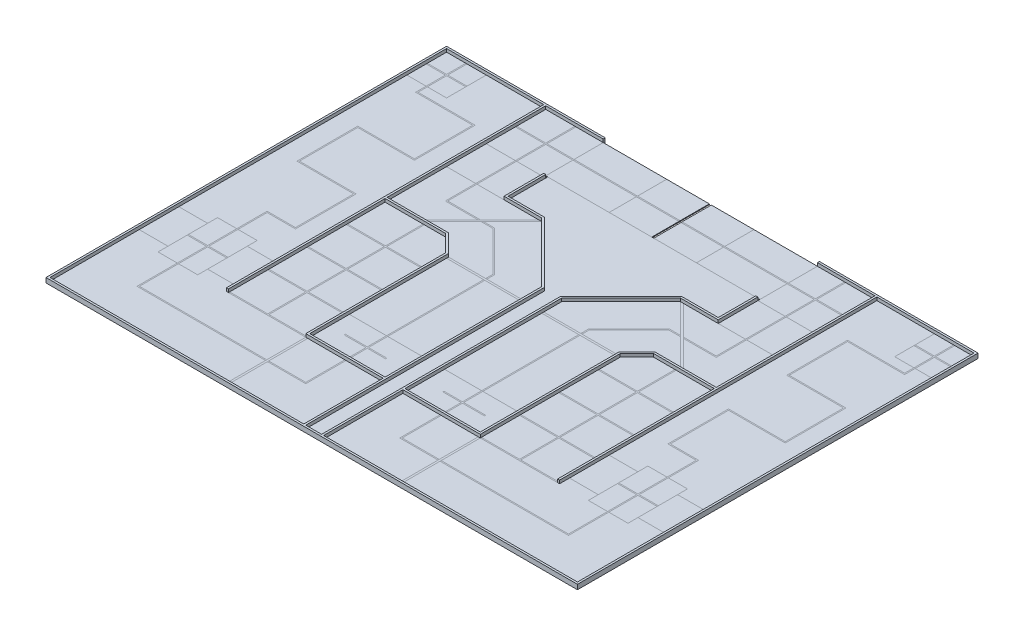
from build123d import *

# Parameters (mm, degrees)
BOSS_EXTRUDE3_DEPTH         = 20
BOSS_EXTRUDE3_2_DEPTH       = 20
BOSS_EXTRUDE3_3_DEPTH       = 20
SKETCH1_W                   = 935
SKETCH1_H                   = 985
BOSS_EXTRUDE3_4_DEPTH       = 20
BOSS_EXTRUDE3_5_DEPTH       = 20
BOSS_EXTRUDE3_6_DEPTH       = 20
BOSS_EXTRUDE4_DEPTH         = 20
BOSS_EXTRUDE4_2_DEPTH       = 20
SKETCH1_11_W                = 485
SKETCH1_11_H                = 485
BOSS_EXTRUDE5_DEPTH         = 20
BOSS_EXTRUDE5_2_DEPTH       = 20
BOSS_EXTRUDE5_3_DEPTH       = 20
BOSS_EXTRUDE5_4_DEPTH       = 20
SKETCH1_11_W_2              = 735
SKETCH1_11_H_2              = 735
BOSS_EXTRUDE5_5_DEPTH       = 20
BOSS_EXTRUDE5_6_DEPTH       = 20
SKETCH1_11_W_3              = 685.333572723
BOSS_EXTRUDE5_7_DEPTH       = 20
BOSS_EXTRUDE5_8_DEPTH       = 20
SKETCH1_11_W_4              = 1075
SKETCH1_11_H_3              = 685
BOSS_EXTRUDE5_9_DEPTH       = 20
BOSS_EXTRUDE5_10_DEPTH      = 20
BOSS_EXTRUDE5_11_DEPTH      = 20
BOSS_EXTRUDE5_12_DEPTH      = 20
SKETCH1_12_W                = 735
SKETCH1_12_H                = 1000
BOSS_EXTRUDE6_DEPTH         = 20
SKETCH1_12_W_2              = 685.333572723
BOSS_EXTRUDE6_2_DEPTH       = 20
BOSS_EXTRUDE7_DEPTH         = 20
BOSS_EXTRUDE7_2_DEPTH       = 20
BOSS_EXTRUDE7_3_DEPTH       = 20
BOSS_EXTRUDE7_4_DEPTH       = 20
SKETCH1_13_W                = 935
SKETCH1_13_H                = 2450
BOSS_EXTRUDE7_5_DEPTH       = 20
BOSS_EXTRUDE7_6_DEPTH       = 20
SKETCH1_13_W_2              = 1600
SKETCH1_13_H_2              = 685
BOSS_EXTRUDE7_7_DEPTH       = 20
SKETCH1_13_H_3              = 735
BOSS_EXTRUDE7_8_DEPTH       = 20
SKETCH1_14_W                = 960
SKETCH1_14_H                = 950
BOSS_EXTRUDE8_DEPTH         = 20
BOSS_EXTRUDE8_2_DEPTH       = 20
SKETCH1_14_H_2              = 960
BOSS_EXTRUDE8_3_DEPTH       = 20
BOSS_EXTRUDE8_4_DEPTH       = 20
BOSS_EXTRUDE8_5_DEPTH       = 20
BOSS_EXTRUDE8_6_DEPTH       = 20
BOSS_EXTRUDE8_7_DEPTH       = 20
BOSS_EXTRUDE8_8_DEPTH       = 20
BOSS_EXTRUDE9_DEPTH         = 20
BOSS_EXTRUDE9_2_DEPTH       = 20
BOSS_EXTRUDE9_3_DEPTH       = 20
BOSS_EXTRUDE9_4_DEPTH       = 20
BOSS_EXTRUDE10_DEPTH        = 20
BOSS_EXTRUDE10_2_DEPTH      = 20
SKETCH1_16_W                = 50
SKETCH1_16_H                = 2000
BOSS_EXTRUDE10_3_DEPTH      = 20
BOSS_EXTRUDE11_DEPTH        = 20
BOSS_EXTRUDE11_DEPTH_BACK   = 2
BOSS_EXTRUDE11_2_DEPTH      = 20
BOSS_EXTRUDE11_2_DEPTH_BACK = 2
BOSS_EXTRUDE11_3_DEPTH      = 20
BOSS_EXTRUDE11_3_DEPTH_BACK = 2
BOSS_EXTRUDE11_4_DEPTH      = 20
BOSS_EXTRUDE11_4_DEPTH_BACK = 2
BOSS_EXTRUDE11_5_DEPTH      = 20
BOSS_EXTRUDE11_5_DEPTH_BACK = 2
BOSS_EXTRUDE11_6_DEPTH      = 20
BOSS_EXTRUDE11_6_DEPTH_BACK = 2
BOSS_EXTRUDE12_DEPTH        = 100
BOSS_EXTRUDE12_DEPTH_BACK   = 20
SKETCH2_W                   = 50
SKETCH2_H                   = 120
SKETCH2_W_2                 = 46
SKETCH2_H_2                 = 116
BOSS_EXTRUDE13_DEPTH        = 6900
BOSS_EXTRUDE14_DEPTH        = 20


with BuildPart() as part:
    # Sketch1 → Boss-Extrude3 (new body)
    with BuildSketch(Plane(origin=(0, 0, 0), x_dir=(1, 0, 0), z_dir=(0, 1, 0))):
        Polygon((-4535.012052667, -2011.166173264), (-4535.012052667, 4738.833826736), (-5985.012052667, 4738.833826736), (-5985.012052667, 3738.833826736), (-6470.012052667, 3738.833826736), (-6470.012052667, 3503.833826736), (-5030.012052667, 3503.833826736), (-5030.012052667, 1973.833826736), (-6460.012052667, 1973.833826736), (-6460.012052667, 503.833826736), (-5030.012052667, 503.833826736), (-5030.012052667, -1026.166173264), (-5745.012052667, -1026.166173264), (-5745.012052667, -1761.166173264), (-5260.012052667, -1761.166173264), (-5260.012052667, -2011.166173264), align=None)
    extrude(amount=BOSS_EXTRUDE3_DEPTH)


with BuildPart() as body_2:
    # Sketch1 → Boss-Extrude3 2 (new body)
    with BuildSketch(Plane(origin=(0, 0, 0), x_dir=(1, 0, 0), z_dir=(0, 1, 0))):
        Polygon((-4535.012052667, -3142.252694401), (-4535.012052667, -3011.166173264), (-5260.012052667, -3011.166173264), (-5260.012052667, -3261.166173264), (-5745.012052667, -3261.166173264), (-5745.012052667, -4246.166173264), (-2535.012052667, -4246.166173264), (-2535.012052667, -3261.166173264), (-4535.012052667, -3261.166173264), align=None)
    extrude(amount=BOSS_EXTRUDE3_2_DEPTH)


with BuildPart() as body_3:
    # Sketch1 → Boss-Extrude3 3 (new body)
    with BuildSketch(Plane(origin=(0, 0, 0), x_dir=(1, 0, 0), z_dir=(0, 1, 0))):
        Polygon((-6260.012052667, -1761.166173264), (-5775.012052667, -1761.166173264), (-5775.012052667, -996.166173264), (-5060.012052667, -996.166173264), (-5060.012052667, 473.833826736), (-6490.012052667, 473.833826736), (-6490.012052667, 2003.833826736), (-5060.012052667, 2003.833826736), (-5060.012052667, 3473.833826736), (-6500.012052667, 3473.833826736), (-6500.012052667, 3738.833826736), (-6985.012052667, 3738.833826736), (-6985.012052667, -2011.166173264), (-6260.012052667, -2011.166173264), align=None)
    extrude(amount=BOSS_EXTRUDE3_3_DEPTH)


with BuildPart() as body_4:
    # Sketch1 → Boss-Extrude3 4 (new body)
    with BuildSketch(Plane(origin=(0, 0, 0), x_dir=(1, 0, 0), z_dir=(0, 1, 0))):
        with Locations((-2017.512052667, -3753.666173264)):
            Rectangle(SKETCH1_W, SKETCH1_H)
    extrude(amount=BOSS_EXTRUDE3_4_DEPTH)


with BuildPart() as body_5:
    # Sketch1 → Boss-Extrude3 5 (new body)
    with BuildSketch(Plane(origin=(0, 0, 0), x_dir=(1, 0, 0), z_dir=(0, 1, 0))):
        Polygon((-5775.012052667, -4276.166173264), (-5775.012052667, -3261.166173264), (-6260.012052667, -3261.166173264), (-6260.012052667, -3011.166173264), (-6985.012052667, -3011.166173264), (-6985.012052667, -5261.166173264), (-2535.012052667, -5261.166173264), (-2535.012052667, -4276.166173264), align=None)
    extrude(amount=BOSS_EXTRUDE3_5_DEPTH)


with BuildPart() as body_6:
    # Sketch1 → Boss-Extrude3 6 (new body)
    with BuildSketch(Plane(origin=(0, 0, 0), x_dir=(1, 0, 0), z_dir=(0, 1, 0))):
        Polygon((-585.012052667, -3261.166173264), (-1520.012052667, -3261.166173264), (-1520.012052667, -4276.166173264), (-2485.012052667, -4276.166173264), (-2485.012052667, -5261.166173264), (-585.012052667, -5261.166173264), align=None)
    extrude(amount=BOSS_EXTRUDE3_6_DEPTH)


with BuildPart() as body_7:
    # Sketch1<10> → Boss-Extrude4 (new body)
    with BuildSketch(Plane(origin=(0, 0, 0), x_dir=(1, 0, 0), z_dir=(0, 1, 0))):
        Polygon((-6260.012052667, -2496.166173264), (-6260.012052667, -2011.166173264), (-6985.012052667, -2011.166173264), (-6985.012052667, -3011.166173264), (-6260.012052667, -3011.166173264), (-6260.012052667, -2526.166173264), align=None)
    extrude(amount=BOSS_EXTRUDE4_DEPTH)


with BuildPart() as body_8:
    # Sketch1<10> → Boss-Extrude4 2 (new body)
    with BuildSketch(Plane(origin=(0, 0, 0), x_dir=(1, 0, 0), z_dir=(0, 1, 0))):
        Polygon((-4535.012052667, -3011.166173264), (-4535.012052667, -2011.166173264), (-5260.012052667, -2011.166173264), (-5260.012052667, -2496.166173264), (-5260.012052667, -2526.166173264), (-5260.012052667, -3011.166173264), align=None)
    extrude(amount=BOSS_EXTRUDE4_2_DEPTH)


with BuildPart() as body_9:
    # Sketch1<11> → Boss-Extrude5 (new body)
    with BuildSketch(Plane(origin=(0, 0, 0), x_dir=(1, 0, 0), z_dir=(0, 1, 0))):
        with Locations((-6742.512052667, 4496.333826736)):
            Rectangle(SKETCH1_11_W, SKETCH1_11_H)
    extrude(amount=BOSS_EXTRUDE5_DEPTH)


with BuildPart() as body_10:
    # Sketch1<11> → Boss-Extrude5 2 (new body)
    with BuildSketch(Plane(origin=(0, 0, 0), x_dir=(1, 0, 0), z_dir=(0, 1, 0))):
        with Locations((-6742.512052667, 3981.333826736)):
            Rectangle(SKETCH1_11_W, SKETCH1_11_H)
    extrude(amount=BOSS_EXTRUDE5_2_DEPTH)


with BuildPart() as body_11:
    # Sketch1<11> → Boss-Extrude5 3 (new body)
    with BuildSketch(Plane(origin=(0, 0, 0), x_dir=(1, 0, 0), z_dir=(0, 1, 0))):
        with Locations((-6227.512052667, 4496.333826736)):
            Rectangle(SKETCH1_11_W, SKETCH1_11_H)
    extrude(amount=BOSS_EXTRUDE5_3_DEPTH)


with BuildPart() as body_12:
    # Sketch1<11> → Boss-Extrude5 4 (new body)
    with BuildSketch(Plane(origin=(0, 0, 0), x_dir=(1, 0, 0), z_dir=(0, 1, 0))):
        with Locations((-6227.512052667, 3981.333826736)):
            Rectangle(SKETCH1_11_W, SKETCH1_11_H)
    extrude(amount=BOSS_EXTRUDE5_4_DEPTH)


with BuildPart() as body_13:
    # Sketch1<11> → Boss-Extrude5 5 (new body)
    with BuildSketch(Plane(origin=(0, 0, 0), x_dir=(1, 0, 0), z_dir=(0, 1, 0))):
        with Locations((-4117.512052667, 3606.333826736)):
            Rectangle(SKETCH1_11_W_2, SKETCH1_11_H_2)
    extrude(amount=BOSS_EXTRUDE5_5_DEPTH)


with BuildPart() as body_14:
    # Sketch1<11> → Boss-Extrude5 6 (new body)
    with BuildSketch(Plane(origin=(0, 0, 0), x_dir=(1, 0, 0), z_dir=(0, 1, 0))):
        with Locations((-4117.512052667, 4371.333826736)):
            Rectangle(SKETCH1_11_W_2, SKETCH1_11_H_2)
    extrude(amount=BOSS_EXTRUDE5_6_DEPTH)


with BuildPart() as body_15:
    # Sketch1<11> → Boss-Extrude5 7 (new body)
    with BuildSketch(Plane(origin=(0, 0, 0), x_dir=(1, 0, 0), z_dir=(0, 1, 0))):
        with Locations((-3377.678839029, 4371.333826736)):
            Rectangle(SKETCH1_11_W_3, SKETCH1_11_H_2)
    extrude(amount=BOSS_EXTRUDE5_7_DEPTH)


with BuildPart() as body_16:
    # Sketch1<11> → Boss-Extrude5 8 (new body)
    with BuildSketch(Plane(origin=(0, 0, 0), x_dir=(1, 0, 0), z_dir=(0, 1, 0))):
        Polygon((-3035.012052667, 3288.833826736), (-3035.012052667, 3973.833826736), (-3720.34562539, 3973.833826736), (-3720.34562539, 3238.833826736), (-3035.012052667, 3238.833826736), align=None)
    extrude(amount=BOSS_EXTRUDE5_8_DEPTH)


with BuildPart() as body_17:
    # Sketch1<11> → Boss-Extrude5 9 (new body)
    with BuildSketch(Plane(origin=(0, 0, 0), x_dir=(1, 0, 0), z_dir=(0, 1, 0))):
        with Locations((-897.512052667, 3631.333826736)):
            Rectangle(SKETCH1_11_W_4, SKETCH1_11_H_3)
    extrude(amount=BOSS_EXTRUDE5_9_DEPTH)


with BuildPart() as body_18:
    # Sketch1<11> → Boss-Extrude5 10 (new body)
    with BuildSketch(Plane(origin=(0, 0, 0), x_dir=(1, 0, 0), z_dir=(0, 1, 0))):
        with Locations((-897.512052667, 4371.333826736)):
            Rectangle(SKETCH1_11_W_4, SKETCH1_11_H_2)
    extrude(amount=BOSS_EXTRUDE5_10_DEPTH)


with BuildPart() as body_19:
    # Sketch1<11> → Boss-Extrude5 11 (new body)
    with BuildSketch(Plane(origin=(0, 0, 0), x_dir=(1, 0, 0), z_dir=(0, 1, 0))):
        Polygon((-2485.012052667, -2211.166173264), (-2485.012052667, -3211.166173264), (-1550.012052667, -3211.166173264), (-1550.012052667, -2726.166173264), (-2102.609996802, -2726.166173264), (-2102.609996802, -2696.166173264), (-1550.012052667, -2696.166173264), (-1550.012052667, -2211.166173264), align=None)
    extrude(amount=BOSS_EXTRUDE5_11_DEPTH)


with BuildPart() as body_20:
    # Sketch1<11> → Boss-Extrude5 12 (new body)
    with BuildSketch(Plane(origin=(0, 0, 0), x_dir=(1, 0, 0), z_dir=(0, 1, 0))):
        Polygon((-585.012052667, -3211.166173264), (-585.012052667, -2211.166173264), (-1520.012052667, -2211.166173264), (-1520.012052667, -2696.166173264), (-1056.101210726, -2696.166173264), (-1056.101210726, -2726.166173264), (-1520.012052667, -2726.166173264), (-1520.012052667, -3211.166173264), align=None)
    extrude(amount=BOSS_EXTRUDE5_12_DEPTH)


with BuildPart() as body_21:
    # Sketch1<12> → Boss-Extrude6 (new body)
    with BuildSketch(Plane(origin=(0, 0, 0), x_dir=(1, 0, 0), z_dir=(0, 1, 0))):
        with Locations((-4117.512052667, 2738.833826736)):
            Rectangle(SKETCH1_12_W, SKETCH1_12_H)
    extrude(amount=BOSS_EXTRUDE6_DEPTH)


with BuildPart() as body_22:
    # Sketch1<12> → Boss-Extrude6 2 (new body)
    with BuildSketch(Plane(origin=(0, 0, 0), x_dir=(1, 0, 0), z_dir=(0, 1, 0))):
        with Locations((-3377.678839029, 2738.833826736)):
            Rectangle(SKETCH1_12_W_2, SKETCH1_12_H)
    extrude(amount=BOSS_EXTRUDE6_2_DEPTH)


with BuildPart() as body_23:
    # Sketch1<13> → Boss-Extrude7 (new body)
    with BuildSketch(Plane(origin=(0, 0, 0), x_dir=(1, 0, 0), z_dir=(0, 1, 0))):
        Polygon((-3750.012052667, 1480.344564331), (-3750.012052667, 2238.833826736), (-4485.012052667, 2238.833826736), (-4485.012052667, 738.833826736), (-3655.722730786, 738.833826736), (-3620.367391727, 774.189165796), (-2920.722730786, 1473.833826736), (-3750.012052667, 1473.833826736), align=None)
    extrude(amount=BOSS_EXTRUDE7_DEPTH)


with BuildPart() as body_24:
    # Sketch1<13> → Boss-Extrude7 2 (new body)
    with BuildSketch(Plane(origin=(0, 0, 0), x_dir=(1, 0, 0), z_dir=(0, 1, 0))):
        Polygon((-3035.012052667, 2238.833826736), (-3720.34562539, 2238.833826736), (-3720.34562539, 1503.833826736), (-2890.722730786, 1503.833826736), (-2155.722730786, 2238.833826736), align=None)
    extrude(amount=BOSS_EXTRUDE7_2_DEPTH)


with BuildPart() as body_25:
    # Sketch1<13> → Boss-Extrude7 3 (new body)
    with BuildSketch(Plane(origin=(0, 0, 0), x_dir=(1, 0, 0), z_dir=(0, 1, 0))):
        Polygon((-585.012052667, 738.833826736), (-2085.012052667, 2238.833826736), (-2820.012052667, 1503.833826736), (-2535.012052667, 1503.833826736), (-1520.012052667, 488.833826736), (-1520.012052667, 288.833826736), (-585.012052667, 288.833826736), align=None)
    extrude(amount=BOSS_EXTRUDE7_3_DEPTH)


with BuildPart() as body_26:
    # Sketch1<13> → Boss-Extrude7 4 (new body)
    with BuildSketch(Plane(origin=(0, 0, 0), x_dir=(1, 0, 0), z_dir=(0, 1, 0))):
        Polygon((-2547.438459539, 1473.833826736), (-2850.012052667, 1473.833826736), (-3585.012052667, 738.833826736), (-2935.012052667, 738.833826736), (-2485.012052667, 288.833826736), (-1550.012052667, 288.833826736), (-1550.012052667, 476.407419865), align=None)
    extrude(amount=BOSS_EXTRUDE7_4_DEPTH)


with BuildPart() as body_27:
    # Sketch1<13> → Boss-Extrude7 5 (new body)
    with BuildSketch(Plane(origin=(0, 0, 0), x_dir=(1, 0, 0), z_dir=(0, 1, 0))):
        with Locations((-2017.512052667, -986.166173264)):
            Rectangle(SKETCH1_13_W, SKETCH1_13_H)
    extrude(amount=BOSS_EXTRUDE7_5_DEPTH)


with BuildPart() as body_28:
    # Sketch1<13> → Boss-Extrude7 6 (new body)
    with BuildSketch(Plane(origin=(0, 0, 0), x_dir=(1, 0, 0), z_dir=(0, 1, 0))):
        with Locations((-1052.512052667, -986.166173264)):
            Rectangle(SKETCH1_13_W, SKETCH1_13_H)
    extrude(amount=BOSS_EXTRUDE7_6_DEPTH)


with BuildPart() as body_29:
    # Sketch1<13> → Boss-Extrude7 7 (new body)
    with BuildSketch(Plane(origin=(0, 0, 0), x_dir=(1, 0, 0), z_dir=(0, 1, 0))):
        with Locations((-2235.012052667, 3631.333826736)):
            Rectangle(SKETCH1_13_W_2, SKETCH1_13_H_2)
    extrude(amount=BOSS_EXTRUDE7_7_DEPTH)


with BuildPart() as body_30:
    # Sketch1<13> → Boss-Extrude7 8 (new body)
    with BuildSketch(Plane(origin=(0, 0, 0), x_dir=(1, 0, 0), z_dir=(0, 1, 0))):
        with Locations((-2235.012052667, 4371.333826736)):
            Rectangle(SKETCH1_13_W_2, SKETCH1_13_H_3)
    extrude(amount=BOSS_EXTRUDE7_8_DEPTH)


with BuildPart() as body_31:
    # Sketch1<14> → Boss-Extrude8 (new body)
    with BuildSketch(Plane(origin=(0, 0, 0), x_dir=(1, 0, 0), z_dir=(0, 1, 0))):
        with Locations((-4005.012052667, 213.833826736)):
            Rectangle(SKETCH1_14_W, SKETCH1_14_H)
    extrude(amount=BOSS_EXTRUDE8_DEPTH)


with BuildPart() as body_32:
    # Sketch1<14> → Boss-Extrude8 2 (new body)
    with BuildSketch(Plane(origin=(0, 0, 0), x_dir=(1, 0, 0), z_dir=(0, 1, 0))):
        Polygon((-2955.722730786, 688.833826736), (-3495.012052667, 688.833826736), (-3495.012052667, -261.166173264), (-2535.012052667, -261.166173264), (-2535.012052667, 268.123148618), align=None)
    extrude(amount=BOSS_EXTRUDE8_2_DEPTH)


with BuildPart() as body_33:
    # Sketch1<14> → Boss-Extrude8 3 (new body)
    with BuildSketch(Plane(origin=(0, 0, 0), x_dir=(1, 0, 0), z_dir=(0, 1, 0))):
        with Locations((-4005.012052667, -771.166173264)):
            Rectangle(SKETCH1_14_W, SKETCH1_14_H_2)
    extrude(amount=BOSS_EXTRUDE8_3_DEPTH)


with BuildPart() as body_34:
    # Sketch1<14> → Boss-Extrude8 4 (new body)
    with BuildSketch(Plane(origin=(0, 0, 0), x_dir=(1, 0, 0), z_dir=(0, 1, 0))):
        with Locations((-3015.012052667, -771.166173264)):
            Rectangle(SKETCH1_14_W, SKETCH1_14_H_2)
    extrude(amount=BOSS_EXTRUDE8_4_DEPTH)


with BuildPart() as body_35:
    # Sketch1<14> → Boss-Extrude8 5 (new body)
    with BuildSketch(Plane(origin=(0, 0, 0), x_dir=(1, 0, 0), z_dir=(0, 1, 0))):
        with Locations((-4005.012052667, -1761.166173264)):
            Rectangle(SKETCH1_14_W, SKETCH1_14_H_2)
    extrude(amount=BOSS_EXTRUDE8_5_DEPTH)


with BuildPart() as body_36:
    # Sketch1<14> → Boss-Extrude8 6 (new body)
    with BuildSketch(Plane(origin=(0, 0, 0), x_dir=(1, 0, 0), z_dir=(0, 1, 0))):
        with Locations((-3015.012052667, -1761.166173264)):
            Rectangle(SKETCH1_14_W, SKETCH1_14_H_2)
    extrude(amount=BOSS_EXTRUDE8_6_DEPTH)


with BuildPart() as body_37:
    # Sketch1<14> → Boss-Extrude8 7 (new body)
    with BuildSketch(Plane(origin=(0, 0, 0), x_dir=(1, 0, 0), z_dir=(0, 1, 0))):
        with Locations((-4005.012052667, -2751.166173264)):
            Rectangle(SKETCH1_14_W, SKETCH1_14_H_2)
    extrude(amount=BOSS_EXTRUDE8_7_DEPTH)


with BuildPart() as body_38:
    # Sketch1<14> → Boss-Extrude8 8 (new body)
    with BuildSketch(Plane(origin=(0, 0, 0), x_dir=(1, 0, 0), z_dir=(0, 1, 0))):
        with Locations((-3015.012052667, -2751.166173264)):
            Rectangle(SKETCH1_14_W, SKETCH1_14_H_2)
    extrude(amount=BOSS_EXTRUDE8_8_DEPTH)


with BuildPart() as body_39:
    # Sketch1<15> → Boss-Extrude9 (new body)
    with BuildSketch(Plane(origin=(0, 0, 0), x_dir=(1, 0, 0), z_dir=(0, 1, 0))):
        Polygon((-5775.012052667, -2496.166173264), (-5775.012052667, -1761.166173264), (-6260.012052667, -1761.166173264), (-6260.012052667, -2011.166173264), (-6260.012052667, -2496.166173264), align=None)
    extrude(amount=BOSS_EXTRUDE9_DEPTH)


with BuildPart() as body_40:
    # Sketch1<15> → Boss-Extrude9 2 (new body)
    with BuildSketch(Plane(origin=(0, 0, 0), x_dir=(1, 0, 0), z_dir=(0, 1, 0))):
        Polygon((-5260.012052667, -2496.166173264), (-5260.012052667, -2011.166173264), (-5260.012052667, -1761.166173264), (-5745.012052667, -1761.166173264), (-5745.012052667, -2496.166173264), align=None)
    extrude(amount=BOSS_EXTRUDE9_2_DEPTH)


with BuildPart() as body_41:
    # Sketch1<15> → Boss-Extrude9 3 (new body)
    with BuildSketch(Plane(origin=(0, 0, 0), x_dir=(1, 0, 0), z_dir=(0, 1, 0))):
        Polygon((-6260.012052667, -3261.166173264), (-5775.012052667, -3261.166173264), (-5775.012052667, -2526.166173264), (-6260.012052667, -2526.166173264), (-6260.012052667, -3011.166173264), align=None)
    extrude(amount=BOSS_EXTRUDE9_3_DEPTH)


with BuildPart() as body_42:
    # Sketch1<15> → Boss-Extrude9 4 (new body)
    with BuildSketch(Plane(origin=(0, 0, 0), x_dir=(1, 0, 0), z_dir=(0, 1, 0))):
        Polygon((-5260.012052667, -3261.166173264), (-5260.012052667, -3011.166173264), (-5260.012052667, -2526.166173264), (-5745.012052667, -2526.166173264), (-5745.012052667, -3261.166173264), align=None)
    extrude(amount=BOSS_EXTRUDE9_4_DEPTH)


with BuildPart() as body_43:
    # Sketch1<16> → Boss-Extrude10 (new body)
    with BuildSketch(Plane(origin=(0, 0, 0), x_dir=(1, 0, 0), z_dir=(0, 1, 0))):
        Polygon((-2085.012052667, 2238.833826736), (-2155.722730786, 2238.833826736), (-2890.722730786, 1503.833826736), (-2920.722730786, 1473.833826736), (-3620.367391727, 774.189165796), (-3655.722730786, 738.833826736), (-3585.012052667, 738.833826736), (-2850.012052667, 1473.833826736), (-2820.012052667, 1503.833826736), align=None)
    extrude(amount=BOSS_EXTRUDE10_DEPTH)


with BuildPart() as body_44:
    # Sketch1<16> → Boss-Extrude10 2 (new body)
    with BuildSketch(Plane(origin=(0, 0, 0), x_dir=(1, 0, 0), z_dir=(0, 1, 0))):
        Polygon((-585.012052667, 238.833826736), (-585.012052667, 288.833826736), (-1520.012052667, 288.833826736), (-1550.012052667, 288.833826736), (-2485.012052667, 288.833826736), (-2485.012052667, 238.833826736), (-1550.012052667, 238.833826736), (-1520.012052667, 238.833826736), align=None)
    extrude(amount=BOSS_EXTRUDE10_2_DEPTH)


with BuildPart() as body_45:
    # Sketch1<16> → Boss-Extrude10 3 (new body)
    with BuildSketch(Plane(origin=(0, 0, 0), x_dir=(1, 0, 0), z_dir=(0, 1, 0))):
        with Locations((-2510.012052667, -4261.166173264)):
            Rectangle(SKETCH1_16_W, SKETCH1_16_H)
    extrude(amount=BOSS_EXTRUDE10_3_DEPTH)


with BuildPart() as body_46:
    # Sketch1<20> → Boss-Extrude11 (new, two sides: drawn at the far end of the back side and taken through both)
    with BuildSketch(Plane(origin=(0, 0, 0), x_dir=(1, 0, 0), z_dir=(0, 1, 0)).offset(-BOSS_EXTRUDE11_DEPTH_BACK)):
        Polygon((-360.012052667, 3973.833826736), (-360.012052667, 4003.833826736), (-3720.34562539, 4003.833826736), (-3720.34562539, 4738.833826736), (-3750.012052667, 4738.833826736), (-3750.012052667, 4003.833826736), (-4485.012052667, 4003.833826736), (-4485.012052667, 3973.833826736), (-3750.012052667, 3973.833826736), (-3750.012052667, 1473.833826736), (-2920.722730786, 1473.833826736), (-2890.722730786, 1503.833826736), (-3720.34562539, 1503.833826736), (-3720.34562539, 3973.833826736), align=None)
    extrude(amount=BOSS_EXTRUDE11_DEPTH + BOSS_EXTRUDE11_DEPTH_BACK)


with BuildPart() as body_47:
    # Sketch1<20> → Boss-Extrude11 2 (new, two sides: drawn at the far end of the back side and taken through both)
    with BuildSketch(Plane(origin=(0, 0, 0), x_dir=(1, 0, 0), z_dir=(0, 1, 0)).offset(-BOSS_EXTRUDE11_2_DEPTH_BACK)):
        Polygon((-6470.012052667, 4253.833826736), (-6470.012052667, 4738.833826736), (-6500.012052667, 4738.833826736), (-6500.012052667, 4253.833826736), (-6985.012052667, 4253.833826736), (-6985.012052667, 4223.833826736), (-6500.012052667, 4223.833826736), (-6500.012052667, 3473.833826736), (-5060.012052667, 3473.833826736), (-5060.012052667, 2003.833826736), (-6490.012052667, 2003.833826736), (-6490.012052667, 473.833826736), (-5060.012052667, 473.833826736), (-5060.012052667, -996.166173264), (-5775.012052667, -996.166173264), (-5775.012052667, -2496.166173264), (-6260.012052667, -2496.166173264), (-6260.012052667, -2526.166173264), (-5775.012052667, -2526.166173264), (-5775.012052667, -4276.166173264), (-2535.012052667, -4276.166173264), (-2535.012052667, -4246.166173264), (-5745.012052667, -4246.166173264), (-5745.012052667, -2526.166173264), (-5260.012052667, -2526.166173264), (-5260.012052667, -2496.166173264), (-5745.012052667, -2496.166173264), (-5745.012052667, -1026.166173264), (-5030.012052667, -1026.166173264), (-5030.012052667, 503.833826736), (-6460.012052667, 503.833826736), (-6460.012052667, 1973.833826736), (-5030.012052667, 1973.833826736), (-5030.012052667, 3503.833826736), (-6470.012052667, 3503.833826736), (-6470.012052667, 4223.833826736), (-5985.012052667, 4223.833826736), (-5985.012052667, 4253.833826736), align=None)
    extrude(amount=BOSS_EXTRUDE11_2_DEPTH + BOSS_EXTRUDE11_2_DEPTH_BACK)


with BuildPart() as body_48:
    # Sketch1<20> → Boss-Extrude11 3 (new, two sides: drawn at the far end of the back side and taken through both)
    with BuildSketch(Plane(origin=(0, 0, 0), x_dir=(1, 0, 0), z_dir=(0, 1, 0)).offset(-BOSS_EXTRUDE11_3_DEPTH_BACK)):
        Polygon((-4485.012052667, -3231.166173264), (-4485.012052667, -3261.166173264), (-2535.012052667, -3261.166173264), (-2535.012052667, -3231.166173264), (-3495.012052667, -3231.166173264), (-3495.012052667, -2271.166173264), (-2535.012052667, -2271.166173264), (-2535.012052667, -2241.166173264), (-3495.012052667, -2241.166173264), (-3495.012052667, -1281.166173264), (-2535.012052667, -1281.166173264), (-2535.012052667, -1251.166173264), (-3495.012052667, -1251.166173264), (-3495.012052667, -291.166173264), (-2535.012052667, -291.166173264), (-2535.012052667, -261.166173264), (-3495.012052667, -261.166173264), (-3495.012052667, 688.833826736), (-3525.012052667, 688.833826736), (-3525.012052667, -261.166173264), (-4485.012052667, -261.166173264), (-4485.012052667, -291.166173264), (-3525.012052667, -291.166173264), (-3525.012052667, -1251.166173264), (-4485.012052667, -1251.166173264), (-4485.012052667, -1281.166173264), (-3525.012052667, -1281.166173264), (-3525.012052667, -2241.166173264), (-4485.012052667, -2241.166173264), (-4485.012052667, -2271.166173264), (-3525.012052667, -2271.166173264), (-3525.012052667, -3231.166173264), align=None)
    extrude(amount=BOSS_EXTRUDE11_3_DEPTH + BOSS_EXTRUDE11_3_DEPTH_BACK)


with BuildPart() as body_49:
    # Sketch1<20> → Boss-Extrude11 4 (new, two sides: drawn at the far end of the back side and taken through both)
    with BuildSketch(Plane(origin=(0, 0, 0), x_dir=(1, 0, 0), z_dir=(0, 1, 0)).offset(-BOSS_EXTRUDE11_4_DEPTH_BACK)):
        Polygon((-2535.012052667, 1503.833826736), (-2820.012052667, 1503.833826736), (-2850.012052667, 1473.833826736), (-2547.438459539, 1473.833826736), (-1550.012052667, 476.407419865), (-1550.012052667, 288.833826736), (-1520.012052667, 288.833826736), (-1520.012052667, 488.833826736), align=None)
    extrude(amount=BOSS_EXTRUDE11_4_DEPTH + BOSS_EXTRUDE11_4_DEPTH_BACK)


with BuildPart() as body_50:
    # Sketch1<20> → Boss-Extrude11 5 (new, two sides: drawn at the far end of the back side and taken through both)
    with BuildSketch(Plane(origin=(0, 0, 0), x_dir=(1, 0, 0), z_dir=(0, 1, 0)).offset(-BOSS_EXTRUDE11_5_DEPTH_BACK)):
        Polygon((-1520.012052667, -3261.166173264), (-1550.012052667, -3261.166173264), (-1550.012052667, -4246.166173264), (-2485.012052667, -4246.166173264), (-2485.012052667, -4276.166173264), (-1520.012052667, -4276.166173264), align=None)
    extrude(amount=BOSS_EXTRUDE11_5_DEPTH + BOSS_EXTRUDE11_5_DEPTH_BACK)


with BuildPart() as body_51:
    # Sketch1<20> → Boss-Extrude11 6 (new, two sides: drawn at the far end of the back side and taken through both)
    with BuildSketch(Plane(origin=(0, 0, 0), x_dir=(1, 0, 0), z_dir=(0, 1, 0)).offset(-BOSS_EXTRUDE11_6_DEPTH_BACK)):
        Polygon((-1520.012052667, 238.833826736), (-1550.012052667, 238.833826736), (-1550.012052667, -2696.166173264), (-2102.609996802, -2696.166173264), (-2102.609996802, -2726.166173264), (-1550.012052667, -2726.166173264), (-1550.012052667, -3211.166173264), (-1520.012052667, -3211.166173264), (-1520.012052667, -2726.166173264), (-1056.101210726, -2726.166173264), (-1056.101210726, -2696.166173264), (-1520.012052667, -2696.166173264), align=None)
    extrude(amount=BOSS_EXTRUDE11_6_DEPTH + BOSS_EXTRUDE11_6_DEPTH_BACK)


with BuildPart() as body_52:
    # Sketch1<22> → Boss-Extrude12 (new, two sides: drawn at the far end of the back side and taken through both)
    with BuildSketch(Plane(origin=(0, 0, 0), x_dir=(1, 0, 0), z_dir=(0, 1, 0)).offset(-BOSS_EXTRUDE12_DEPTH_BACK)):
        Polygon((-3035.012052667, 4738.833826736), (-3035.012052667, 4788.833826736), (-7035.012052667, 4788.833826736), (-7035.012052667, -5311.166173264), (-535.012052667, -5311.166173264), (-535.012052667, 759.544504855), (-2064.301374549, 2288.833826736), (-2985.012052667, 2288.833826736), (-2985.012052667, 3238.833826736), (-3035.012052667, 3238.833826736), (-3035.012052667, 2238.833826736), (-2085.012052667, 2238.833826736), (-585.012052667, 738.833826736), (-585.012052667, -3211.166173264), (-2485.012052667, -3211.166173264), (-2485.012052667, 288.833826736), (-2935.012052667, 738.833826736), (-4485.012052667, 738.833826736), (-4485.012052667, 4738.833826736), align=None)
        Polygon((-585.012052667, -3261.166173264), (-585.012052667, -5261.166173264), (-6985.012052667, -5261.166173264), (-6985.012052667, 4738.833826736), (-4535.012052667, 4738.833826736), (-4535.012052667, -3261.166173264), (-4485.012052667, -3261.166173264), (-4485.012052667, 688.833826736), (-2955.722730786, 688.833826736), (-2535.012052667, 268.123148618), (-2535.012052667, -3261.166173264), align=None, mode=Mode.SUBTRACT)
    extrude(amount=BOSS_EXTRUDE12_DEPTH + BOSS_EXTRUDE12_DEPTH_BACK)


with BuildPart() as body_53:
    # Mirror1: mirrored copy
    add(body_5.part.mirror(Plane(origin=(-335.012052667, 0, 0), x_dir=(0, 0, 1), z_dir=(1, 0, 0))))


with BuildPart() as body_54:
    # Mirror1 2: mirrored copy
    add(body_39.part.mirror(Plane(origin=(-335.012052667, 0, 0), x_dir=(0, 0, 1), z_dir=(1, 0, 0))))


with BuildPart() as body_55:
    # Mirror1 3: mirrored copy
    add(body_42.part.mirror(Plane(origin=(-335.012052667, 0, 0), x_dir=(0, 0, 1), z_dir=(1, 0, 0))))


with BuildPart() as body_56:
    # Mirror1 4: mirrored copy
    add(body_40.part.mirror(Plane(origin=(-335.012052667, 0, 0), x_dir=(0, 0, 1), z_dir=(1, 0, 0))))


with BuildPart() as body_57:
    # Mirror1 5: mirrored copy
    add(body_37.part.mirror(Plane(origin=(-335.012052667, 0, 0), x_dir=(0, 0, 1), z_dir=(1, 0, 0))))


with BuildPart() as body_58:
    # Mirror1 6: mirrored copy
    add(body_8.part.mirror(Plane(origin=(-335.012052667, 0, 0), x_dir=(0, 0, 1), z_dir=(1, 0, 0))))


with BuildPart() as body_59:
    # Mirror1 7: mirrored copy
    add(body_38.part.mirror(Plane(origin=(-335.012052667, 0, 0), x_dir=(0, 0, 1), z_dir=(1, 0, 0))))


with BuildPart() as body_60:
    # Mirror1 8: mirrored copy
    add(body_35.part.mirror(Plane(origin=(-335.012052667, 0, 0), x_dir=(0, 0, 1), z_dir=(1, 0, 0))))


with BuildPart() as body_61:
    # Mirror1 9: mirrored copy
    add(body_9.part.mirror(Plane(origin=(-335.012052667, 0, 0), x_dir=(0, 0, 1), z_dir=(1, 0, 0))))


with BuildPart() as body_62:
    # Mirror1 10: mirrored copy
    add(part.part.mirror(Plane(origin=(-335.012052667, 0, 0), x_dir=(0, 0, 1), z_dir=(1, 0, 0))))


with BuildPart() as body_63:
    # Mirror1 11: mirrored copy
    add(body_21.part.mirror(Plane(origin=(-335.012052667, 0, 0), x_dir=(0, 0, 1), z_dir=(1, 0, 0))))


with BuildPart() as body_64:
    # Mirror1 12: mirrored copy
    add(body_23.part.mirror(Plane(origin=(-335.012052667, 0, 0), x_dir=(0, 0, 1), z_dir=(1, 0, 0))))


with BuildPart() as body_65:
    # Mirror1 13: mirrored copy
    add(body_13.part.mirror(Plane(origin=(-335.012052667, 0, 0), x_dir=(0, 0, 1), z_dir=(1, 0, 0))))


with BuildPart() as body_66:
    # Mirror1 14: mirrored copy
    add(body_10.part.mirror(Plane(origin=(-335.012052667, 0, 0), x_dir=(0, 0, 1), z_dir=(1, 0, 0))))


with BuildPart() as body_67:
    # Mirror1 15: mirrored copy
    add(body_43.part.mirror(Plane(origin=(-335.012052667, 0, 0), x_dir=(0, 0, 1), z_dir=(1, 0, 0))))


with BuildPart() as body_68:
    # Mirror1 16: mirrored copy
    add(body_14.part.mirror(Plane(origin=(-335.012052667, 0, 0), x_dir=(0, 0, 1), z_dir=(1, 0, 0))))


with BuildPart() as body_69:
    # Mirror1 17: mirrored copy
    add(body_12.part.mirror(Plane(origin=(-335.012052667, 0, 0), x_dir=(0, 0, 1), z_dir=(1, 0, 0))))


with BuildPart() as body_70:
    # Mirror1 18: mirrored copy
    add(body_30.part.mirror(Plane(origin=(-335.012052667, 0, 0), x_dir=(0, 0, 1), z_dir=(1, 0, 0))))


with BuildPart() as body_71:
    # Mirror1 19: mirrored copy
    add(body_15.part.mirror(Plane(origin=(-335.012052667, 0, 0), x_dir=(0, 0, 1), z_dir=(1, 0, 0))))


with BuildPart() as body_72:
    # Mirror1 20: mirrored copy
    add(body_29.part.mirror(Plane(origin=(-335.012052667, 0, 0), x_dir=(0, 0, 1), z_dir=(1, 0, 0))))


with BuildPart() as body_73:
    # Mirror1 21: mirrored copy
    add(body_16.part.mirror(Plane(origin=(-335.012052667, 0, 0), x_dir=(0, 0, 1), z_dir=(1, 0, 0))))


with BuildPart() as body_74:
    # Mirror1 22: mirrored copy
    add(body_17.part.mirror(Plane(origin=(-335.012052667, 0, 0), x_dir=(0, 0, 1), z_dir=(1, 0, 0))))


with BuildPart() as body_75:
    # Mirror1 23: mirrored copy
    add(body_18.part.mirror(Plane(origin=(-335.012052667, 0, 0), x_dir=(0, 0, 1), z_dir=(1, 0, 0))))


with BuildPart() as body_76:
    # Mirror1 24: mirrored copy
    add(body_25.part.mirror(Plane(origin=(-335.012052667, 0, 0), x_dir=(0, 0, 1), z_dir=(1, 0, 0))))


with BuildPart() as body_77:
    # Mirror1 25: mirrored copy
    add(body_26.part.mirror(Plane(origin=(-335.012052667, 0, 0), x_dir=(0, 0, 1), z_dir=(1, 0, 0))))


with BuildPart() as body_78:
    # Mirror1 26: mirrored copy
    add(body_27.part.mirror(Plane(origin=(-335.012052667, 0, 0), x_dir=(0, 0, 1), z_dir=(1, 0, 0))))


with BuildPart() as body_79:
    # Mirror1 27: mirrored copy
    add(body_28.part.mirror(Plane(origin=(-335.012052667, 0, 0), x_dir=(0, 0, 1), z_dir=(1, 0, 0))))


with BuildPart() as body_80:
    # Mirror1 28: mirrored copy
    add(body_19.part.mirror(Plane(origin=(-335.012052667, 0, 0), x_dir=(0, 0, 1), z_dir=(1, 0, 0))))


with BuildPart() as body_81:
    # Mirror1 29: mirrored copy
    add(body_20.part.mirror(Plane(origin=(-335.012052667, 0, 0), x_dir=(0, 0, 1), z_dir=(1, 0, 0))))


with BuildPart() as body_82:
    # Mirror1 30: mirrored copy
    add(body_6.part.mirror(Plane(origin=(-335.012052667, 0, 0), x_dir=(0, 0, 1), z_dir=(1, 0, 0))))


with BuildPart() as body_83:
    # Mirror1 31: mirrored copy
    add(body_4.part.mirror(Plane(origin=(-335.012052667, 0, 0), x_dir=(0, 0, 1), z_dir=(1, 0, 0))))


with BuildPart() as body_84:
    # Mirror1 32: mirrored copy
    add(body_2.part.mirror(Plane(origin=(-335.012052667, 0, 0), x_dir=(0, 0, 1), z_dir=(1, 0, 0))))


with BuildPart() as body_85:
    # Mirror1 33: mirrored copy
    add(body_41.part.mirror(Plane(origin=(-335.012052667, 0, 0), x_dir=(0, 0, 1), z_dir=(1, 0, 0))))


with BuildPart() as body_86:
    # Mirror1 34: mirrored copy
    add(body_3.part.mirror(Plane(origin=(-335.012052667, 0, 0), x_dir=(0, 0, 1), z_dir=(1, 0, 0))))


with BuildPart() as body_87:
    # Mirror1 35: mirrored copy
    add(body_7.part.mirror(Plane(origin=(-335.012052667, 0, 0), x_dir=(0, 0, 1), z_dir=(1, 0, 0))))


with BuildPart() as body_88:
    # Mirror1 36: mirrored copy
    add(body_11.part.mirror(Plane(origin=(-335.012052667, 0, 0), x_dir=(0, 0, 1), z_dir=(1, 0, 0))))


with BuildPart() as body_89:
    # Mirror1 37: mirrored copy
    add(body_24.part.mirror(Plane(origin=(-335.012052667, 0, 0), x_dir=(0, 0, 1), z_dir=(1, 0, 0))))


with BuildPart() as body_90:
    # Mirror1 38: mirrored copy
    add(body_46.part.mirror(Plane(origin=(-335.012052667, 0, 0), x_dir=(0, 0, 1), z_dir=(1, 0, 0))))


with BuildPart() as body_91:
    # Mirror1 39: mirrored copy
    add(body_52.part.mirror(Plane(origin=(-335.012052667, 0, 0), x_dir=(0, 0, 1), z_dir=(1, 0, 0))))


with BuildPart() as body_92:
    # Mirror1 40: mirrored copy
    add(body_33.part.mirror(Plane(origin=(-335.012052667, 0, 0), x_dir=(0, 0, 1), z_dir=(1, 0, 0))))


with BuildPart() as body_93:
    # Mirror1 41: mirrored copy
    add(body_34.part.mirror(Plane(origin=(-335.012052667, 0, 0), x_dir=(0, 0, 1), z_dir=(1, 0, 0))))


with BuildPart() as body_94:
    # Mirror1 42: mirrored copy
    add(body_32.part.mirror(Plane(origin=(-335.012052667, 0, 0), x_dir=(0, 0, 1), z_dir=(1, 0, 0))))


with BuildPart() as body_95:
    # Mirror1 43: mirrored copy
    add(body_31.part.mirror(Plane(origin=(-335.012052667, 0, 0), x_dir=(0, 0, 1), z_dir=(1, 0, 0))))


with BuildPart() as body_96:
    # Mirror1 44: mirrored copy
    add(body_36.part.mirror(Plane(origin=(-335.012052667, 0, 0), x_dir=(0, 0, 1), z_dir=(1, 0, 0))))


with BuildPart() as body_97:
    # Mirror1 45: mirrored copy
    add(body_45.part.mirror(Plane(origin=(-335.012052667, 0, 0), x_dir=(0, 0, 1), z_dir=(1, 0, 0))))


with BuildPart() as body_98:
    # Mirror1 46: mirrored copy
    add(body_50.part.mirror(Plane(origin=(-335.012052667, 0, 0), x_dir=(0, 0, 1), z_dir=(1, 0, 0))))


with BuildPart() as body_99:
    # Mirror1 47: mirrored copy
    add(body_51.part.mirror(Plane(origin=(-335.012052667, 0, 0), x_dir=(0, 0, 1), z_dir=(1, 0, 0))))


with BuildPart() as body_100:
    # Mirror1 48: mirrored copy
    add(body_48.part.mirror(Plane(origin=(-335.012052667, 0, 0), x_dir=(0, 0, 1), z_dir=(1, 0, 0))))


with BuildPart() as body_101:
    # Mirror1 49: mirrored copy
    add(body_44.part.mirror(Plane(origin=(-335.012052667, 0, 0), x_dir=(0, 0, 1), z_dir=(1, 0, 0))))


with BuildPart() as body_102:
    # Mirror1 50: mirrored copy
    add(body_49.part.mirror(Plane(origin=(-335.012052667, 0, 0), x_dir=(0, 0, 1), z_dir=(1, 0, 0))))


with BuildPart() as body_103:
    # Mirror1 51: mirrored copy
    add(body_22.part.mirror(Plane(origin=(-335.012052667, 0, 0), x_dir=(0, 0, 1), z_dir=(1, 0, 0))))


with BuildPart() as body_104:
    # Mirror1 52: mirrored copy
    add(body_47.part.mirror(Plane(origin=(-335.012052667, 0, 0), x_dir=(0, 0, 1), z_dir=(1, 0, 0))))


with BuildPart() as body_52_1:
    add(body_52.part)

    add(body_91.part)  # Boss-Extrude13 merges body 91
    # Sketch2 → Boss-Extrude13 (add)
    with BuildSketch(Plane(origin=(-535.012052667, 0, 0), x_dir=(0, 0, -1), z_dir=(1, 0, 0))):
        with Locations((-5286.166173264, 40)):
            Rectangle(SKETCH2_W, SKETCH2_H)
        with Locations((-5286.166173264, 40)):
            Rectangle(SKETCH2_W_2, SKETCH2_H_2, mode=Mode.SUBTRACT)
    extrude(amount=BOSS_EXTRUDE13_DEPTH)


with BuildPart() as body_104_2:
    # Sketch3 → Boss-Extrude14 (new body)
    with BuildSketch(Plane(origin=(0, 20, 0), x_dir=(1, 0, 0), z_dir=(0, 1, 0))):
        Polygon((-2985.012052667, 3288.833826736), (-1435.012052667, 3288.833826736), (-310.012052667, 3288.833826736), (764.987947333, 3288.833826736), (2314.987947333, 3288.833826736), (2314.987947333, 2288.833826736), (1394.277269214, 2288.833826736), (-135.012052667, 759.544504855), (-135.012052667, -5261.166173264), (-535.012052667, -5261.166173264), (-535.012052667, 759.544504855), (-2064.301374549, 2288.833826736), (-2985.012052667, 2288.833826736), align=None)
    extrude(amount=-BOSS_EXTRUDE14_DEPTH)


solid = Compound([part.part, body_2.part, body_3.part, body_4.part, body_5.part, body_6.part, body_7.part, body_8.part, body_9.part, body_10.part, body_11.part, body_12.part, body_13.part, body_14.part, body_15.part, body_16.part, body_17.part, body_18.part, body_19.part, body_20.part, body_21.part, body_22.part, body_23.part, body_24.part, body_25.part, body_26.part, body_27.part, body_28.part, body_29.part, body_30.part, body_31.part, body_32.part, body_33.part, body_34.part, body_35.part, body_36.part, body_37.part, body_38.part, body_39.part, body_40.part, body_41.part, body_42.part, body_43.part, body_44.part, body_45.part, body_46.part, body_47.part, body_48.part, body_49.part, body_50.part, body_51.part, body_53.part, body_54.part, body_55.part, body_56.part, body_57.part, body_58.part, body_59.part, body_60.part, body_61.part, body_62.part, body_63.part, body_64.part, body_65.part, body_66.part, body_67.part, body_68.part, body_69.part, body_70.part, body_71.part, body_72.part, body_73.part, body_74.part, body_75.part, body_76.part, body_77.part, body_78.part, body_79.part, body_80.part, body_81.part, body_82.part, body_83.part, body_84.part, body_85.part, body_86.part, body_87.part, body_88.part, body_89.part, body_90.part, body_92.part, body_93.part, body_94.part, body_95.part, body_96.part, body_97.part, body_98.part, body_99.part, body_100.part, body_101.part, body_102.part, body_103.part, body_104.part, body_52_1.part, body_104_2.part])
